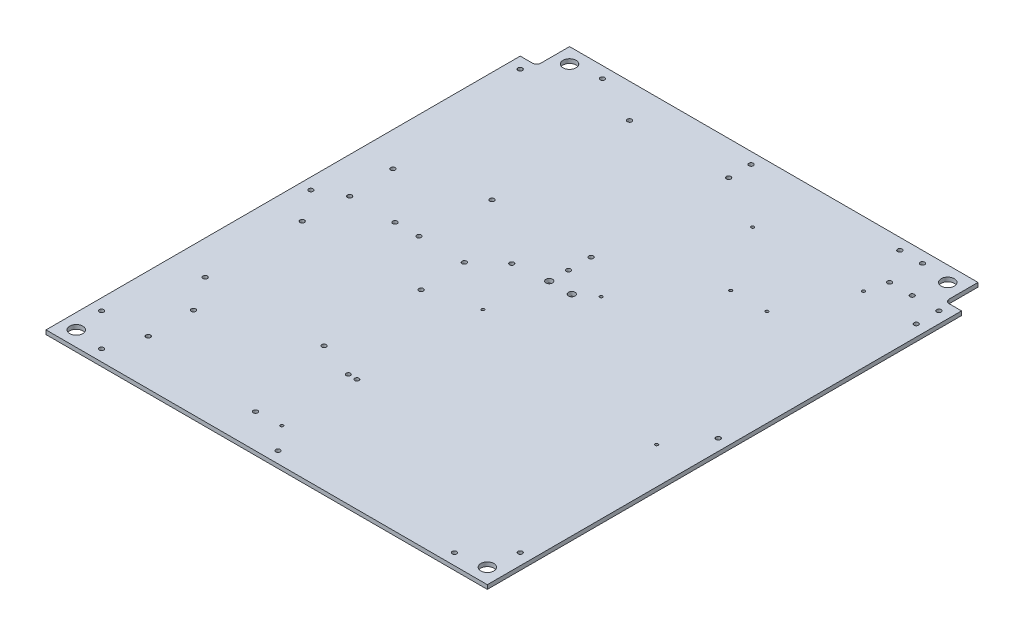
from build123d import *

# Parameters (mm, degrees)
SKETCH1_W                 = 340.868
SKETCH1_H                 = 391.668
BOSS_EXTRUDE1_DEPTH       = 3.175
CUT_EXTRUDE1_DEPTH        = 10
F_3_8_CLEARANCE_HOLE1_D   = 10.0838
F_4_40_TAPPED_HOLE2_D     = 2.2606
F_8_32_TAPPED_HOLE2_D     = 3.4544
F_4_CLEARANCE_HOLE1_D     = 3.2639
F_4_CLEARANCE_HOLE1_DEPTH = 8.01
F_4_CLEARANCE_HOLE1_TIP   = 0.980574487
F_10_CLEARANCE_HOLE1_D    = 5.1054


with BuildPart() as part:
    # Sketch1 → Boss-Extrude1 (new body)
    with BuildSketch(Plane(origin=(0, 0, 0), x_dir=(1, 0, 0), z_dir=(0, 1, 0))):
        Rectangle(SKETCH1_W, SKETCH1_H)
    extrude(amount=BOSS_EXTRUDE1_DEPTH)

    # Sketch2 → Cut-Extrude1 (cut)
    with BuildSketch(Plane(origin=(0, 3.175, 0), x_dir=(1, 0, 0), z_dir=(0, 1, 0))):
        with BuildLine():
            Line((-170.434, 195.834), (-157.734, 195.834))
            Line((-157.734, 195.834), (-157.734, 173.609))
            ThreePointArc((-157.734, 173.609), (-158.66393597, 171.36393597), (-160.909, 170.434))
            Line((-160.909, 170.434), (-170.434, 170.434))
            Line((-170.434, 170.434), (-170.434, 195.834))
        make_face()
        with BuildLine():
            Line((170.434, 195.834), (157.734, 195.834))
            Line((157.734, 195.834), (157.734, 173.609))
            ThreePointArc((157.734, 173.609), (158.66393597, 171.36393597), (160.909, 170.434))
            Line((160.909, 170.434), (170.434, 170.434))
            Line((170.434, 170.434), (170.434, 195.834))
        make_face()
    extrude(amount=-CUT_EXTRUDE1_DEPTH, mode=Mode.SUBTRACT)

    # 3/8 Clearance Hole1 (through all)
    with Locations(Plane(origin=(0, 3.175, 0), x_dir=(1, 0, 0), z_dir=(0, 1, 0))):
        with Locations((158.75, -184.15), (-158.75, -184.15), (-146.05, 184.15), (146.05, 184.15)):
            Hole(F_3_8_CLEARANCE_HOLE1_D / 2)

    # #4-40 Tapped Hole2 (through all)
    with Locations(Plane(origin=(0, 3.175, 0), x_dir=(1, 0, 0), z_dir=(0, 1, 0))):
        with Locations((119.375, 145.759), (33.725, 145.759), (21.73, 40.754), (67.7, 94.894), (95.6, 94.894), (-15.34, -13.51), (142.14, -36.73), (-15.34, -168.81)):
            Hole(F_4_40_TAPPED_HOLE2_D / 2)

    # #8-32 Tapped Hole2 (through all)
    with Locations(Plane(origin=(0, 3.175, 0), x_dir=(1, 0, 0), z_dir=(0, 1, 0))):
        with Locations((-161.684, -161.684), (-161.684, 0), (-161.684, 161.684), (-144.184, 45.834), (-8.584, 45.834), (-144.184, -24.166), (-52.384, -24.166), (-144.184, -99.166), (-52.384, -99.166), (-34.884, 28.334), (-34.884, -169.584), (-136.284, -187.084), (0, -187.084), (136.284, -187.084), (161.684, -161.684), (161.684, -8.75), (161.684, 144.184), (141.084, 161.684), (161.684, 161.684), (123.584, 161.684), (123.584, 187.084), (106.084, 187.084), (-123.584, 187.084), (-8.75, 187.084), (-8.584, 169.584), (-8.584, 63.334), (-142.534, 10.834), (-107.534, 10.834), (-89.034, 10.834), (-54.034, 10.834), (-85.134, 63.334), (-85.134, 169.584), (-126.684, -125.625), (-126.684, -160.625)):
            Hole(F_8_32_TAPPED_HOLE2_D / 2)

    # #4 Clearance Hole1
    with Locations(Plane(origin=(0, 3.175, 0), x_dir=(1, 0, 0), z_dir=(0, 1, 0))):
        with Locations((-23.925625, -108.8644), (-17.274375, -108.8644)):
            Hole(F_4_CLEARANCE_HOLE1_D / 2, depth=F_4_CLEARANCE_HOLE1_DEPTH)
            with Locations((0, 0, -(F_4_CLEARANCE_HOLE1_DEPTH + F_4_CLEARANCE_HOLE1_TIP / 2))):  # 118° drill point
                Cone(0, F_4_CLEARANCE_HOLE1_D / 2, F_4_CLEARANCE_HOLE1_TIP, mode=Mode.SUBTRACT)

    # #10 Clearance Hole1 (through all)
    with Locations(Plane(origin=(0, 0, 0), x_dir=(-1, 0, 0), z_dir=(0, -1, 0))):
        with Locations((8.7376, 31.1216), (-8.7376, 31.1216)):
            Hole(F_10_CLEARANCE_HOLE1_D / 2)


solid = part.part
